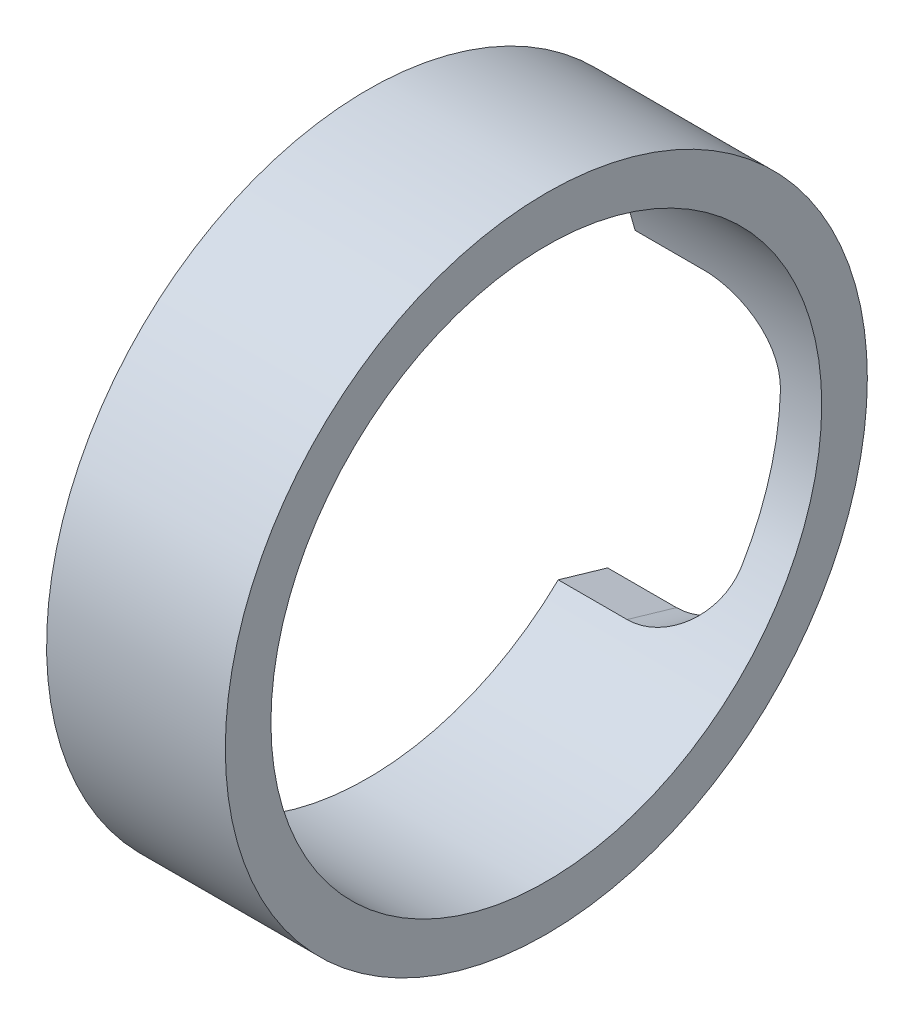
from build123d import *

# Parameters (mm, degrees)
SKETCH1_W          = 4.949999982
SKETCH1_H          = 1.263000014
CUT_EXTRUDE1_REACH = 45.424


with BuildPart() as part:
    # Sketch1 → Revolve1 (revolve)
    with BuildSketch(Plane.XY):
        with Locations((-36.903124961, 8.258499993)):
            Rectangle(SKETCH1_W, SKETCH1_H)
    revolve(axis=Axis((0, 0, 0), (-1, 0, 0)))

    # Sketch3 → Cut-Extrude1 (cut, up to next)
    with BuildSketch(Plane(origin=(0, -1.746488682, -6.004183776), x_dir=(-1, 0, 0), z_dir=(0, -0.27930256399882136, -0.9602031439980211)), mode=Mode.PRIVATE) as cut_extrude1_sk1:
        with BuildLine():
            Line((39.378124952, 3.81), (39.378124952, -3.81))
            Line((39.378124952, -3.81), (37.473124952, -3.81))
            ThreePointArc((37.473124952, -3.81), (36.126086534, -3.252038418), (35.568124952, -1.905))
            Line((35.568124952, -1.905), (35.568124952, 1.905))
            ThreePointArc((35.568124952, 1.905), (36.126086534, 3.252038418), (37.473124952, 3.81))
            Line((37.473124952, 3.81), (39.378124952, 3.81))
        make_face()
    cut_extrude1_tool1 = extrude(cut_extrude1_sk1.sketch, amount=CUT_EXTRUDE1_REACH, mode=Mode.PRIVATE) & part.part
    add(cut_extrude1_tool1.solids().sort_by_distance((-37.557, -1.746489, -6.004184))[0], mode=Mode.SUBTRACT)


solid = part.part
